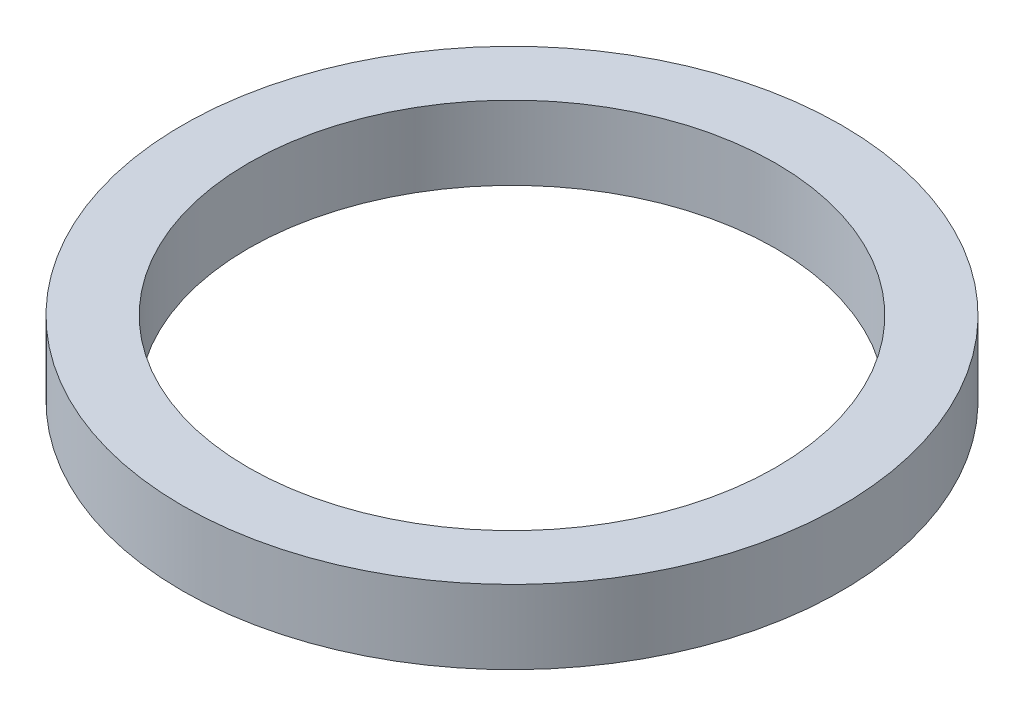
from build123d import *

# Parameters (mm, degrees)
SKETCH1_R           = 62.5
BOSS_EXTRUDE1_DEPTH = 14
SKETCH2_R           = 50
CUT_EXTRUDE1_DEPTH  = 90.49022293


with BuildPart() as part:
    # Sketch1 → Boss-Extrude1 (new body)
    with BuildSketch(Plane(origin=(0, 0, 0), x_dir=(1, 0, 0), z_dir=(0, 1, 0))):
        Circle(SKETCH1_R)
    extrude(amount=BOSS_EXTRUDE1_DEPTH)

    # Sketch2 → Cut-Extrude1 (cut, through all)
    with BuildSketch(Plane(origin=(0, 0, 0), x_dir=(1, 0, 0), z_dir=(0, 1, 0))):
        Circle(SKETCH2_R)
    extrude(amount=CUT_EXTRUDE1_DEPTH, mode=Mode.SUBTRACT)


solid = part.part
